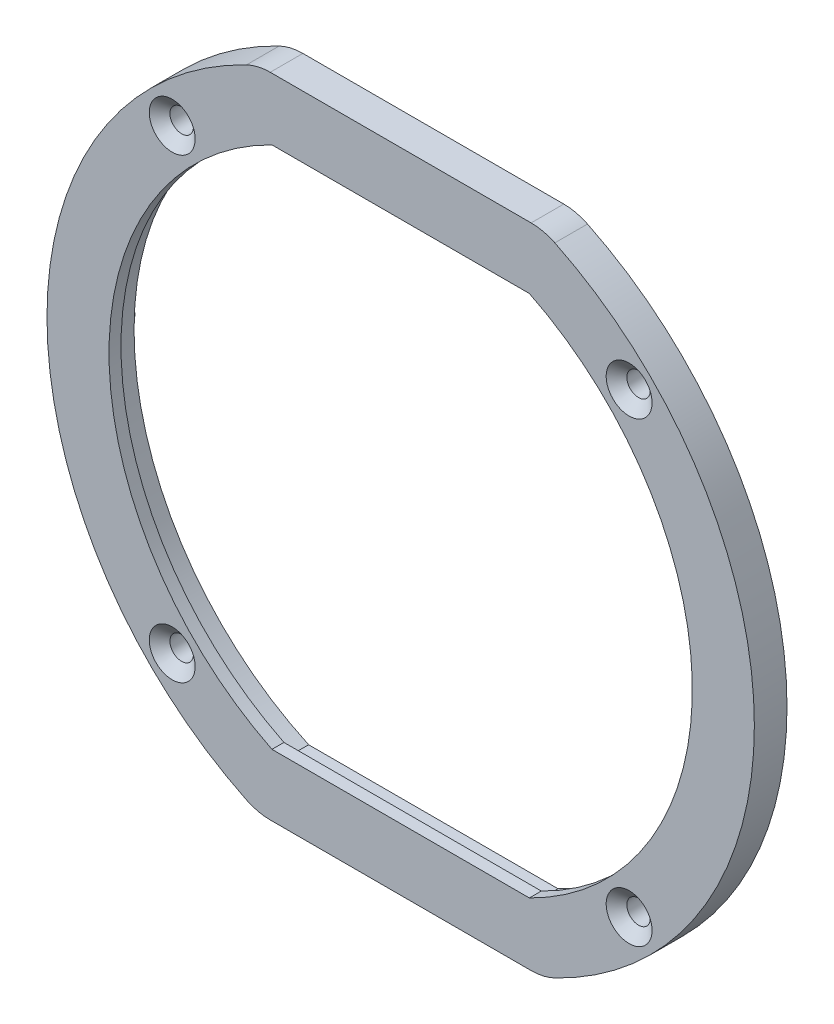
from build123d import *

# Parameters (mm, degrees)
BOSS_EXTRUDE1_DEPTH                               = 6
CSK_FOR_8_FLAT_HEAD_MACHINE_SCREW_100_D           = 4.3053
CSK_FOR_8_FLAT_HEAD_MACHINE_SCREW_100_CSINK_D     = 8.4328
CSK_FOR_8_FLAT_HEAD_MACHINE_SCREW_100_CSINK_ANGLE = 100
SKETCH5_R                                         = 1.905
BOSS_EXTRUDE2_DEPTH                               = 2.5
FILLET1_R                                         = 10
CUT_EXTRUDE1_DEPTH                                = 3.8


with BuildPart() as part:
    # Sketch1 → Boss-Extrude1 (new body)
    with BuildSketch(Plane.XY):
        with BuildLine():
            Line((-26.167728216, 59.5), (26.167728216, 59.5))
            ThreePointArc((26.167728216, 59.5), (65, 0), (26.167728216, -59.5))
            Line((26.167728216, -59.5), (-26.167728216, -59.5))
            ThreePointArc((-26.167728216, -59.5), (-65, 0), (-26.167728216, 59.5))
        make_face()
        with BuildLine():
            Line((-23.650581388, 48.1), (23.650581388, 48.1))
            ThreePointArc((23.650581388, 48.1), (53.6, 0), (23.650581388, -48.1))
            Line((23.650581388, -48.1), (-23.650581388, -48.1))
            ThreePointArc((-23.650581388, -48.1), (-53.6, 0), (-23.650581388, 48.1))
        make_face(mode=Mode.SUBTRACT)
    extrude(amount=BOSS_EXTRUDE1_DEPTH)

    # CSK for #8 Flat Head Machine Screw (100)1 (through all)
    with Locations(Plane.XY.offset(6)):
        with Locations((0, 0), (41.985, 41.985), (-41.985, -41.985), (-41.985, 41.985), (41.985, -41.985)):
            CounterSinkHole(CSK_FOR_8_FLAT_HEAD_MACHINE_SCREW_100_D / 2, CSK_FOR_8_FLAT_HEAD_MACHINE_SCREW_100_CSINK_D / 2, counter_sink_angle=CSK_FOR_8_FLAT_HEAD_MACHINE_SCREW_100_CSINK_ANGLE)

    # Sketch5 → Boss-Extrude2 (add)
    with BuildSketch(Plane(origin=(0, 0, 0), x_dir=(-1, 0, 0), z_dir=(0, 0, -1))):
        with Locations((-59.2455, 0)):
            Circle(SKETCH5_R)
        with Locations((59.2455, 0)):
            Circle(SKETCH5_R)
    extrude(amount=BOSS_EXTRUDE2_DEPTH)

    # Fillet1
    fillet1_edges = [part.edges().sort_by_distance(p)[0] for p in [
        (26.167728216, -59.5, 3),
        (-26.167728216, -59.5, 3),
        (26.167728216, 59.5, 3),
        (-26.167728216, 59.5, 3),
    ]]
    fillet(fillet1_edges, radius=FILLET1_R)

    # Sketch6 → Cut-Extrude1 (cut)
    with BuildSketch(Plane(origin=(0, 0, 0), x_dir=(-1, 0, 0), z_dir=(0, 0, -1))):
        with BuildLine():
            Line((22.912878475, 50), (-22.912878475, 50))
            ThreePointArc((-22.912878475, 50), (-55, 0), (-22.912878475, -50))
            Line((-22.912878475, -50), (22.912878475, -50))
            ThreePointArc((22.912878475, -50), (55, 0), (22.912878475, 50))
        make_face()
    extrude(amount=-CUT_EXTRUDE1_DEPTH, mode=Mode.SUBTRACT)


solid = part.part
